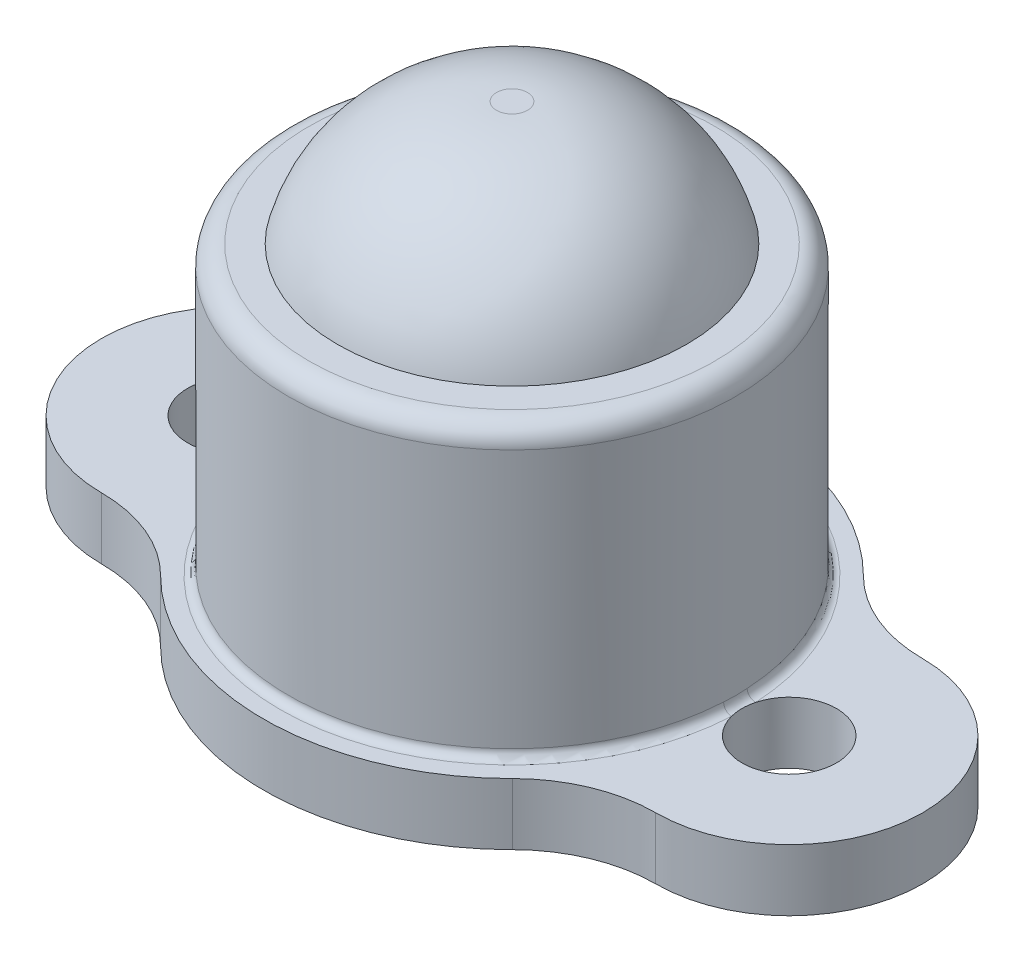
from build123d import *

# Parameters (mm, degrees)
SKETCH1_R           = 2.946896199
BOSS_EXTRUDE1_DEPTH = 1.5
SKETCH2_R           = 1.15
CUT_EXTRUDE1_DEPTH  = 12.783569069
SKETCH3_R           = 5.446896199
SKETCH3_R_2         = 2.946896199
BOSS_EXTRUDE2_DEPTH = 7
SKETCH4_R           = 4.25
BOSS_EXTRUDE3_DEPTH = 3
FILLET1_R           = 4
FILLET2_R           = 0.5
FILLET3_R           = 0.2


with BuildPart() as part:
    # Sketch1 → Boss-Extrude1 (new body)
    with BuildSketch(Plane(origin=(0, 0, 0), x_dir=(1, 0, 0), z_dir=(0, 1, 0))):
        with BuildLine():
            ThreePointArc((-4.282383784, -4.273603764), (0, -6.05), (4.282383784, -4.273603764))
            ThreePointArc((4.282383784, -4.273603764), (5.414251665, -3.516053121), (6.75, -3.25))
            ThreePointArc((6.75, -3.25), (10, 0), (6.75, 3.25))
            ThreePointArc((6.75, 3.25), (5.414251665, 3.516053121), (4.282383784, 4.273603764))
            ThreePointArc((4.282383784, 4.273603764), (0, 6.05), (-4.282383784, 4.273603764))
            ThreePointArc((-4.282383784, 4.273603764), (-5.414251665, 3.516053121), (-6.75, 3.25))
            ThreePointArc((-6.75, 3.25), (-10, 0), (-6.75, -3.25))
            ThreePointArc((-6.75, -3.25), (-5.414251665, -3.516053121), (-4.282383784, -4.273603764))
        make_face()
        with Locations(Location((0, 0, 0), (0, 0, 270))):
            Circle(SKETCH1_R, mode=Mode.SUBTRACT)
    extrude(amount=BOSS_EXTRUDE1_DEPTH)

    # Sketch2 → Cut-Extrude1 (cut, through all)
    with BuildSketch(Plane(origin=(0, 1.5, 0), x_dir=(1, 0, 0), z_dir=(0, 1, 0))):
        with Locations(Location((-6.75, 0, 0), (0, 0, 270))):
            Circle(SKETCH2_R)
        with Locations(Location((6.75, 0, 0), (0, 0, 90))):
            Circle(SKETCH2_R)
    extrude(amount=-CUT_EXTRUDE1_DEPTH, mode=Mode.SUBTRACT)

    # Sketch3 → Boss-Extrude2 (add)
    with BuildSketch(Plane(origin=(0, 1.5, 0), x_dir=(1, 0, 0), z_dir=(0, 1, 0))):
        with Locations(Location((0, 0, 0), (0, 0, 270))):
            Circle(SKETCH3_R)
        with Locations(Location((0, 0, 0), (0, 0, 270))):
            Circle(SKETCH3_R_2, mode=Mode.SUBTRACT)
    extrude(amount=BOSS_EXTRUDE2_DEPTH)

    # Sketch4 → Boss-Extrude3 (add)
    with BuildSketch(Plane(origin=(0, 8.5, 0), x_dir=(1, 0, 0), z_dir=(0, 1, 0))):
        with Locations(Location((0, 0, 0), (0, 0, 270))):
            Circle(SKETCH4_R)
    extrude(amount=BOSS_EXTRUDE3_DEPTH)

    # Fillet1
    # the kernel refuses this fillet: 4 mm, written as the material it takes off along each edge
    with BuildSketch(Plane(origin=(0, 11.5, 0), x_dir=(0, 0, 1), z_dir=(-1, 0, 0))) as fillet1_piece_1:
        with BuildLine():
            CenterArc((0.377016654, -4), FILLET1_R, 14.477512186, 75.522487814)
            Line((0.377016654, 0), (0.377016654, 0.08))
            Line((0.377016654, 0.08), (4.25, 0.08))
            Line((4.25, 0.08), (4.33, 0))
            ThreePointArc((4.33, 0), (4.33, -1.5), (4.327459667, -2.98))
            Line((4.327459667, -2.98), (4.25, -3))
        make_face()
    revolve(axis=Axis((0, 11.5, 0), (0, 1, 0)), mode=Mode.SUBTRACT)

    # Fillet2
    fillet2_edges = [part.edges().sort_by_distance(p)[0] for p in [
        (0, 8.5, -5.446896199),
    ]]
    fillet(fillet2_edges, radius=FILLET2_R)

    # Fillet3
    fillet3_edges = [part.edges().sort_by_distance(p)[0] for p in [
        (0, 1.5, -5.446896199),
    ]]
    fillet(fillet3_edges, radius=FILLET3_R)


solid = part.part
